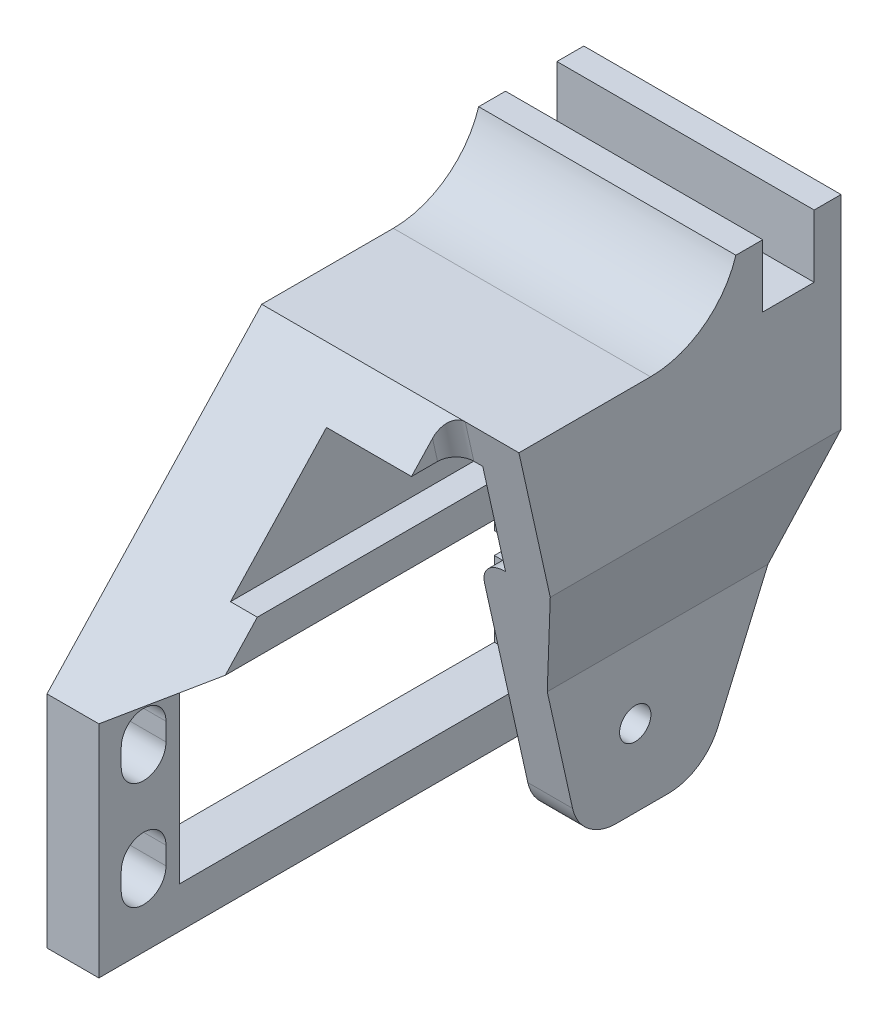
from build123d import *

# Parameters (mm, degrees)
BOSS_EXTRUDE1_DEPTH     = 60
CUT_EXTRUDE1_REACH      = 252.16
SKETCH4_W               = 41
SKETCH4_H               = 20
CUT_EXTRUDE2_DEPTH      = 1
CUT_EXTRUDE2_DEPTH_BACK = 1.4
CUT_EXTRUDE2_START      = -14
SKETCH2_R               = 1.75
CUT_EXTRUDE3_DEPTH      = 5
SKETCH6_W               = 3
SKETCH6_H               = 7
BOSS_EXTRUDE2_DEPTH     = 28.75
FILLET1_R               = 10
CUT_EXTRUDE4_REACH      = 252.16
CUT_EXTRUDE5_REACH      = 252.16
CUT_EXTRUDE6_REACH      = 252.16
FILLET2_R               = 5
FILLET3_R               = 6
FILLET4_R               = 2


with BuildPart() as part:
    # Sketch1 → Boss-Extrude1 (new body)
    with BuildSketch(Plane.XY):
        with BuildLine():
            Line((391.716436469, -195.128416651), (404.216436469, -195.128416651))
            Line((404.216436469, -195.128416651), (404.216436469, -206.578416651))
            ThreePointArc((404.216436469, -206.578416651), (402.095116126, -207.457096307), (401.216436469, -209.578416651))
            Line((401.216436469, -209.578416651), (401.216436469, -235.169373092))
            Line((401.216436469, -235.169373092), (406.216436469, -235.169373092))
            Line((406.216436469, -235.169373092), (406.216436469, -218.547748038))
            Line((406.216436469, -218.547748038), (409.216436469, -206.578416651))
            Line((409.216436469, -206.578416651), (409.216436469, -190.835999092))
            Line((409.216436469, -190.835999092), (380.466436469, -190.835999092))
            Line((380.466436469, -190.835999092), (380.466436469, -241.150690411))
            Line((380.466436469, -241.150690411), (386.266436469, -241.150690411))
            Line((386.266436469, -241.150690411), (386.266436469, -216.54774804))
            Line((386.266436469, -216.54774804), (394.716436469, -210.46208716))
            Line((394.716436469, -210.46208716), (394.716436469, -206.628416651))
            Line((394.716436469, -206.628416651), (391.716436469, -206.628416651))
            Line((391.716436469, -206.628416651), (391.716436469, -195.128416651))
        make_face()
    extrude(amount=BOSS_EXTRUDE1_DEPTH)

    # Cut-Extrude1: up to this face of the body (flat: up to its plane)
    cut_extrude1_end = Plane(part.part.faces().sort_by_distance((386.266436469, -228.849219226, 30))[0])
    # Sketch4 → Cut-Extrude1 (cut, up to the picked face)
    with BuildSketch(Plane.ZY.offset(-380.466436469), mode=Mode.PRIVATE) as cut_extrude1_sk1:
        with BuildLine():
            Line((57.5, -232.04774804), (57.5, -234.04774804))
            ThreePointArc((57.5, -234.04774804), (55, -236.54774804), (52.5, -234.04774804))
            Line((52.5, -234.04774804), (52.5, -232.04774804))
            ThreePointArc((52.5, -232.04774804), (55, -229.54774804), (57.5, -232.04774804))
        make_face()
    cut_extrude1_tool1 = split(extrude(cut_extrude1_sk1.sketch, amount=-CUT_EXTRUDE1_REACH, mode=Mode.PRIVATE), bisect_by=cut_extrude1_end, keep=Keep.BOTH, mode=Mode.PRIVATE)
    # Sketch4 → Cut-Extrude1 (cut, up to the picked face)
    with BuildSketch(Plane.ZY.offset(-380.466436469), mode=Mode.PRIVATE) as cut_extrude1_sk2:
        with Locations((30.5, -226.54774804)):
            Rectangle(SKETCH4_W, SKETCH4_H)
    cut_extrude1_tool2 = split(extrude(cut_extrude1_sk2.sketch, amount=-CUT_EXTRUDE1_REACH, mode=Mode.PRIVATE), bisect_by=cut_extrude1_end, keep=Keep.BOTH, mode=Mode.PRIVATE)
    # Sketch4 → Cut-Extrude1 (cut, up to the picked face)
    with BuildSketch(Plane.ZY.offset(-380.466436469), mode=Mode.PRIVATE) as cut_extrude1_sk3:
        with BuildLine():
            Line((8.5, -222.04774804), (8.5, -220.04774804))
            ThreePointArc((8.5, -220.04774804), (6, -217.54774804), (3.5, -220.04774804))
            Line((3.5, -220.04774804), (3.5, -222.04774804))
            ThreePointArc((3.5, -222.04774804), (6, -224.54774804), (8.5, -222.04774804))
        make_face()
    cut_extrude1_tool3 = split(extrude(cut_extrude1_sk3.sketch, amount=-CUT_EXTRUDE1_REACH, mode=Mode.PRIVATE), bisect_by=cut_extrude1_end, keep=Keep.BOTH, mode=Mode.PRIVATE)
    # Sketch4 → Cut-Extrude1 (cut, up to the picked face)
    with BuildSketch(Plane.ZY.offset(-380.466436469), mode=Mode.PRIVATE) as cut_extrude1_sk4:
        with BuildLine():
            Line((3.5, -232.04774804), (3.5, -234.04774804))
            ThreePointArc((3.5, -234.04774804), (6, -236.54774804), (8.5, -234.04774804))
            Line((8.5, -234.04774804), (8.5, -232.04774804))
            ThreePointArc((8.5, -232.04774804), (6, -229.54774804), (3.5, -232.04774804))
        make_face()
    cut_extrude1_tool4 = split(extrude(cut_extrude1_sk4.sketch, amount=-CUT_EXTRUDE1_REACH, mode=Mode.PRIVATE), bisect_by=cut_extrude1_end, keep=Keep.BOTH, mode=Mode.PRIVATE)
    # Sketch4 → Cut-Extrude1 (cut, up to the picked face)
    with BuildSketch(Plane.ZY.offset(-380.466436469), mode=Mode.PRIVATE) as cut_extrude1_sk5:
        with BuildLine():
            Line((57.5, -220.04774804), (57.5, -222.04774804))
            ThreePointArc((57.5, -222.04774804), (55, -224.54774804), (52.5, -222.04774804))
            Line((52.5, -222.04774804), (52.5, -220.04774804))
            ThreePointArc((52.5, -220.04774804), (55, -217.54774804), (57.5, -220.04774804))
        make_face()
    cut_extrude1_tool5 = split(extrude(cut_extrude1_sk5.sketch, amount=-CUT_EXTRUDE1_REACH, mode=Mode.PRIVATE), bisect_by=cut_extrude1_end, keep=Keep.BOTH, mode=Mode.PRIVATE)
    add(cut_extrude1_tool1.solids().sort_by(Axis((380.466436, -233.047748, 55), (1, 0, 0)))[0], mode=Mode.SUBTRACT)
    add(cut_extrude1_tool2.solids().sort_by(Axis((380.466436, -226.547748, 30.5), (1, 0, 0)))[0], mode=Mode.SUBTRACT)
    add(cut_extrude1_tool3.solids().sort_by(Axis((380.466436, -221.047748, 6), (1, 0, 0)))[0], mode=Mode.SUBTRACT)
    add(cut_extrude1_tool4.solids().sort_by(Axis((380.466436, -233.047748, 6), (1, 0, 0)))[0], mode=Mode.SUBTRACT)
    add(cut_extrude1_tool5.solids().sort_by(Axis((380.466436, -221.047748, 55), (1, 0, 0)))[0], mode=Mode.SUBTRACT)

    # Sketch5 → Cut-Extrude2 (cut, two sides: drawn at the far end of the back side and taken through both)
    with BuildSketch(Plane.XZ.offset(241.150690411).offset(CUT_EXTRUDE2_START - CUT_EXTRUDE2_DEPTH_BACK)):
        Polygon((380.466436469, 51), (382.666436469, 51), (382.666436469, 52.5), (381.466436469, 57.2), (380.466436469, 57.2), align=None)
        Polygon((380.466436469, 10), (382.666436469, 10), (382.666436469, 8.5), (381.466436469, 3.8), (380.466436469, 3.8), align=None)
    extrude(amount=CUT_EXTRUDE2_DEPTH + CUT_EXTRUDE2_DEPTH_BACK, mode=Mode.SUBTRACT)

    # Sketch2 → Cut-Extrude3 (cut)
    with BuildSketch(Plane(origin=(406.216436469, 0, 0), x_dir=(0, 0, -1), z_dir=(1, 0, 0))):
        with Locations((-20, -226.54774804)):
            Circle(SKETCH2_R)
    extrude(amount=-CUT_EXTRUDE3_DEPTH, mode=Mode.SUBTRACT)

    # Sketch6 → Boss-Extrude2 (add)
    with BuildSketch(Plane(origin=(409.216436469, 0, 0), x_dir=(0, 0, -1), z_dir=(1, 0, 0))):
        with Locations((-1.5, -187.335999092)):
            Rectangle(SKETCH6_W, SKETCH6_H)
        with Locations((-10.25, -187.335999092)):
            Rectangle(SKETCH6_W, SKETCH6_H)
    extrude(amount=-BOSS_EXTRUDE2_DEPTH)

    # Fillet1
    # the kernel refuses this fillet: 10 mm, written as the material it adds along each edge
    with BuildSketch(Plane(origin=(409.216436469, -190.835999092, 11.75), x_dir=(0, 1, 0), z_dir=(-1, 0, 0))) as fillet1_piece_1:
        with BuildLine():
            CenterArc((10, -9.539392014), FILLET1_R, 107.457603124, 72.542396876)
            Line((0, -9.539392014), (-0.2, -9.539392014))
            Line((-0.2, -9.539392014), (-0.2, 0))
            Line((-0.2, 0), (0, 0.2))
            ThreePointArc((0, 0.2), (3.5, 0.2), (6.94, 0.19078784))
            Line((6.94, 0.19078784), (7, 0))
        make_face()
    extrude(amount=28.75)

    # Cut-Extrude4: up to this face of the body (flat: up to its plane)
    cut_extrude4_end = Plane(part.part.faces().sort_by_distance((409.216436469, -198.059355839, 28.706804471))[0])
    # Sketch7 → Cut-Extrude4 (cut, up to the picked face)
    with BuildSketch(Plane.ZY.offset(-380.466436469), mode=Mode.PRIVATE) as cut_extrude4_sk1:
        Polygon((60, -190.835999092), (36, -190.835999092), (60, -216.54774804), align=None)
    cut_extrude4_tool1 = split(extrude(cut_extrude4_sk1.sketch, amount=-CUT_EXTRUDE4_REACH, mode=Mode.PRIVATE), bisect_by=cut_extrude4_end, keep=Keep.BOTH, mode=Mode.PRIVATE)
    add(cut_extrude4_tool1.solids().sort_by(Axis((380.466436, -199.406582, 52), (1, 0, 0)))[0], mode=Mode.SUBTRACT)

    # Cut-Extrude5: up to this face of the body (flat: up to its plane)
    cut_extrude5_end = Plane(part.part.faces().sort_by_distance((401.216436469, -222.505111575, 29.644283509))[0])
    # Sketch8 → Cut-Extrude5 (cut, up to the picked face)
    with BuildSketch(Plane(origin=(409.216436469, 0, 0), x_dir=(0, 0, -1), z_dir=(1, 0, 0)), mode=Mode.PRIVATE) as cut_extrude5_sk1:
        Polygon((-36, -235.169373092), (-60, -235.169373092), (-60, -190.835999092), (-36, -190.835999092), (-26.135796826, -235.169373092), align=None)
    cut_extrude5_tool1 = split(extrude(cut_extrude5_sk1.sketch, amount=-CUT_EXTRUDE5_REACH, mode=Mode.PRIVATE), bisect_by=cut_extrude5_end, keep=Keep.BOTH, mode=Mode.PRIVATE)
    add(cut_extrude5_tool1.solids().sort_by(Axis((409.216436, -214.262283, 45.393819), (-1, 0, 0)))[0], mode=Mode.SUBTRACT)

    # Cut-Extrude6: up to this face of the body (flat: up to its plane)
    cut_extrude6_end = Plane(part.part.faces().sort_by_distance((401.216436469, -221.894565092, 14.466227032))[0])
    # Sketch10 → Cut-Extrude6 (cut, up to the picked face)
    with BuildSketch(Plane(origin=(409.216436469, 0, 0), x_dir=(0, 0, -1), z_dir=(1, 0, 0)), mode=Mode.PRIVATE) as cut_extrude6_sk1:
        Polygon((0, -206.578416651), (0, -242.75353584), (-15.622362106, -242.75353584), align=None)
    cut_extrude6_tool1 = split(extrude(cut_extrude6_sk1.sketch, amount=-CUT_EXTRUDE6_REACH, mode=Mode.PRIVATE), bisect_by=cut_extrude6_end, keep=Keep.BOTH, mode=Mode.PRIVATE)
    add(cut_extrude6_tool1.solids().sort_by(Axis((409.216436, -230.695163, 5.207454), (-1, 0, 0)))[0], mode=Mode.SUBTRACT)

    # Fillet2
    fillet2_edges = [part.edges().sort_by_distance(p)[0] for p in [
        (403.716436469, -235.169373092, 26.135796826),
    ]]
    fillet(fillet2_edges, radius=FILLET2_R)

    # Fillet3
    fillet3_edges = [part.edges().sort_by_distance(p)[0] for p in [
        (403.716436469, -235.169373092, 12.347112725),
    ]]
    fillet(fillet3_edges, radius=FILLET3_R)

    # Fillet4
    fillet4_edges = [part.edges().sort_by_distance(p)[0] for p in [
        (401.216436469, -192.982207872, 35.522467217),
    ]]
    fillet(fillet4_edges, radius=FILLET4_R)


solid = part.part
